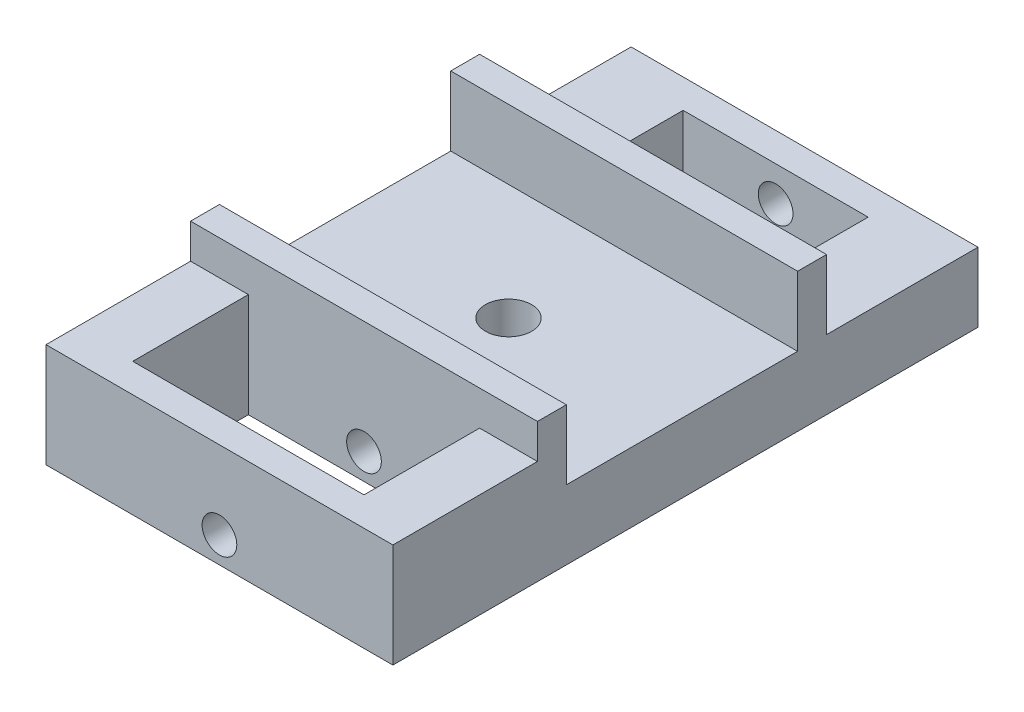
from build123d import *

# Parameters (mm, degrees)
SKETCH1_W           = 30
SKETCH1_H           = 38.1
SKETCH1_W_2         = 16
SKETCH1_H_2         = 10.6
BOSS_EXTRUDE1_DEPTH = 6
SKETCH1_3_W         = 30
SKETCH1_3_H         = 2.5
BOSS_EXTRUDE2_DEPTH = 12
SKETCH3_R           = 1.5
CUT_EXTRUDE2_DEPTH  = 16
SKETCH2_R           = 2
CUT_EXTRUDE1_DEPTH  = 38.976966704
BOSS_EXTRUDE3_DEPTH = 9
SKETCH6_R           = 1.5
CUT_EXTRUDE4_DEPTH  = 20


with BuildPart() as part:
    # Sketch1 → Boss-Extrude1 (new body)
    with BuildSketch(Plane(origin=(0, 0, 0), x_dir=(1, 0, 0), z_dir=(0, 1, 0))):
        with Locations((-15, -3.45)):
            Rectangle(SKETCH1_W, SKETCH1_H)
        with Locations((-15, 7.8)):
            Rectangle(SKETCH1_W_2, SKETCH1_H_2, mode=Mode.SUBTRACT)
    extrude(amount=BOSS_EXTRUDE1_DEPTH)

    # Sketch1<3> → Boss-Extrude2 (add)
    with BuildSketch(Plane(origin=(0, 0, 0), x_dir=(1, 0, 0), z_dir=(0, 1, 0))):
        with Locations((-15, -21.25)):
            Rectangle(SKETCH1_3_W, SKETCH1_3_H)
        with Locations((-15, 1.25)):
            Rectangle(SKETCH1_3_W, SKETCH1_3_H)
    extrude(amount=BOSS_EXTRUDE2_DEPTH)

    # Sketch3 → Cut-Extrude2 (cut)
    with BuildSketch(Plane(origin=(0, 0, -15.6), x_dir=(-1, 0, 0), z_dir=(0, 0, -1))):
        with Locations((15, 3)):
            Circle(SKETCH3_R)
    extrude(amount=-CUT_EXTRUDE2_DEPTH, mode=Mode.SUBTRACT)

    # Sketch2 → Cut-Extrude1 (cut, through all)
    with BuildSketch(Plane(origin=(0, 6, 0), x_dir=(1, 0, 0), z_dir=(0, 1, 0))):
        with Locations((-15, -10)):
            Circle(SKETCH2_R)
    extrude(amount=-CUT_EXTRUDE1_DEPTH, mode=Mode.SUBTRACT)

    # Sketch5 → Boss-Extrude3 (add)
    with BuildSketch(Plane.XZ):
        Polygon((-30, 22.5), (-25, 22.5), (-25, 32.5), (-5, 32.5), (-5, 22.5), (0, 22.5), (0, 35), (-30, 35), align=None)
    extrude(amount=-BOSS_EXTRUDE3_DEPTH)

    # Sketch6 → Cut-Extrude4 (cut)
    with BuildSketch(Plane.XY.offset(35)):
        with Locations((-15, 2.25)):
            Circle(SKETCH6_R)
    extrude(amount=-CUT_EXTRUDE4_DEPTH, mode=Mode.SUBTRACT)


solid = part.part
